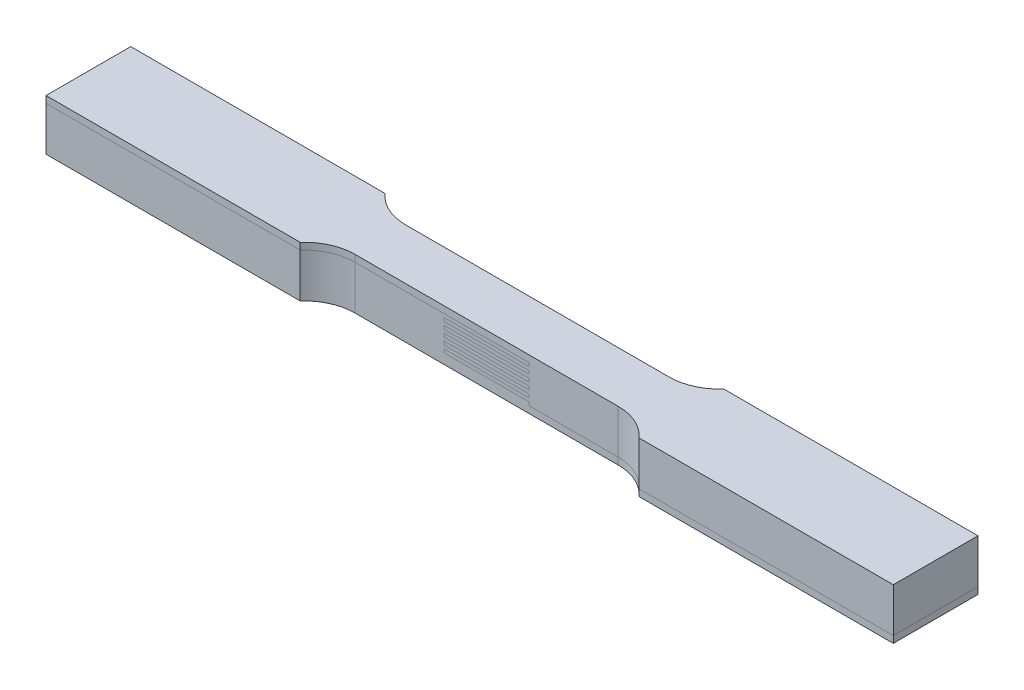
from build123d import *

# Parameters (mm, degrees)
SKETCH1_W            = 5
SKETCH1_H            = 6
BOSS_EXTRUDE7_DEPTH  = 0.4
BOSS_EXTRUDE8_DEPTH  = 0.4
SKETCH4_W            = 5
SKETCH4_H            = 6
BOSS_EXTRUDE9_DEPTH  = 0.4
BOSS_EXTRUDE10_DEPTH = 0.4
LPATTERN2_COUNT      = 25
LPATTERN2_PITCH      = 0.8
LPATTERN3_COUNT      = 25
LPATTERN3_PITCH      = 0.8
BOSS_EXTRUDE11_DEPTH = 0.8
CUT_EXTRUDE1_DEPTH   = 15.6
BOSS_EXTRUDE12_DEPTH = 0.8


with BuildPart() as part:
    # Sketch1 → Boss-Extrude7 (new body)
    with BuildSketch(Plane(origin=(0, 0, 0), x_dir=(1, 0, 0), z_dir=(0, 1, 0))):
        with BuildLine():
            Line((-5, -3), (-5, 3))
            Line((-5, 3), (-15.527864045, 3))
            ThreePointArc((-15.527864045, 3), (-17.977353788, 3.522774425), (-20, 5))
            Line((-20, 5), (-50, 5))
            Line((-50, 5), (-50, -5))
            Line((-50, -5), (-20, -5))
            ThreePointArc((-20, -5), (-17.977353788, -3.522774425), (-15.527864045, -3))
            Line((-15.527864045, -3), (-5, -3))
        make_face()
        with Locations((-2.5, 0)):
            Rectangle(SKETCH1_W, SKETCH1_H)
        with Locations((2.5, 0)):
            Rectangle(SKETCH1_W, SKETCH1_H)
    extrude(amount=BOSS_EXTRUDE7_DEPTH)

    # Sketch4<3> → Boss-Extrude10 (add)
    with BuildSketch(Plane(origin=(0, 0.4, 0), x_dir=(1, 0, 0), z_dir=(0, 1, 0))):
        with BuildLine():
            Line((-5, -3), (-5, 3))
            Line((-5, 3), (-15.527864045, 3))
            ThreePointArc((-15.527864045, 3), (-17.977353788, 3.522774425), (-20, 5))
            Line((-20, 5), (-50, 5))
            Line((-50, 5), (-50, -5))
            Line((-50, -5), (-20, -5))
            ThreePointArc((-20, -5), (-17.977353788, -3.522774425), (-15.527864045, -3))
            Line((-15.527864045, -3), (-5, -3))
        make_face()
    extrude(amount=BOSS_EXTRUDE10_DEPTH)


with BuildPart() as body_2:
    # Sketch1<3> → Boss-Extrude8 (new body)
    with BuildSketch(Plane(origin=(0, 0, 0), x_dir=(1, 0, 0), z_dir=(0, 1, 0))):
        with BuildLine():
            ThreePointArc((20, 5), (17.977353788, 3.522774425), (15.527864045, 3))
            Line((15.527864045, 3), (5, 3))
            Line((5, 3), (5, -3))
            Line((5, -3), (15.527864045, -3))
            ThreePointArc((15.527864045, -3), (17.977353788, -3.522774425), (20, -5))
            Line((20, -5), (50, -5))
            Line((50, -5), (50, 5))
            Line((50, 5), (20, 5))
        make_face()
    extrude(amount=BOSS_EXTRUDE8_DEPTH)

    # Sketch4 → Boss-Extrude9 (add)
    with BuildSketch(Plane(origin=(0, 0.4, 0), x_dir=(1, 0, 0), z_dir=(0, 1, 0))):
        with BuildLine():
            ThreePointArc((20, -5), (17.977353788, -3.522774425), (15.527864045, -3))
            Line((15.527864045, -3), (5, -3))
            Line((5, -3), (5, 3))
            Line((5, 3), (15.527864045, 3))
            ThreePointArc((15.527864045, 3), (17.977353788, 3.522774425), (20, 5))
            Line((20, 5), (50, 5))
            Line((50, 5), (50, -5))
            Line((50, -5), (20, -5))
        make_face()
        with Locations((2.5, 0)):
            Rectangle(SKETCH4_W, SKETCH4_H)
        with Locations((-2.5, 0)):
            Rectangle(SKETCH4_W, SKETCH4_H)
    extrude(amount=BOSS_EXTRUDE9_DEPTH)


with BuildPart() as lpattern2_1:
    # LPattern2: pattern copy
    add(part.part.moved(Location(Vector(0, 1, 0) * (1 * LPATTERN2_PITCH))))


with BuildPart() as lpattern2_2:
    # LPattern2: pattern copy
    add(part.part.moved(Location(Vector(0, 1, 0) * (2 * LPATTERN2_PITCH))))


with BuildPart() as lpattern2_3:
    # LPattern2: pattern copy
    add(part.part.moved(Location(Vector(0, 1, 0) * (3 * LPATTERN2_PITCH))))


with BuildPart() as lpattern2_4:
    # LPattern2: pattern copy
    add(part.part.moved(Location(Vector(0, 1, 0) * (4 * LPATTERN2_PITCH))))


with BuildPart() as lpattern2_5:
    # LPattern2: pattern copy
    add(part.part.moved(Location(Vector(0, 1, 0) * (5 * LPATTERN2_PITCH))))


with BuildPart() as lpattern2_6:
    # LPattern2: pattern copy
    add(part.part.moved(Location(Vector(0, 1, 0) * (6 * LPATTERN2_PITCH))))


with BuildPart() as lpattern2_7:
    # LPattern2: pattern copy
    add(part.part.moved(Location(Vector(0, 1, 0) * (7 * LPATTERN2_PITCH))))


with BuildPart() as lpattern2_8:
    # LPattern2: pattern copy
    add(part.part.moved(Location(Vector(0, 1, 0) * (8 * LPATTERN2_PITCH))))


with BuildPart() as lpattern2_9:
    # LPattern2: pattern copy
    add(part.part.moved(Location(Vector(0, 1, 0) * (9 * LPATTERN2_PITCH))))


with BuildPart() as lpattern2_10:
    # LPattern2: pattern copy
    add(part.part.moved(Location(Vector(0, 1, 0) * (10 * LPATTERN2_PITCH))))


with BuildPart() as lpattern2_11:
    # LPattern2: pattern copy
    add(part.part.moved(Location(Vector(0, 1, 0) * (11 * LPATTERN2_PITCH))))


with BuildPart() as lpattern2_12:
    # LPattern2: pattern copy
    add(part.part.moved(Location(Vector(0, 1, 0) * (12 * LPATTERN2_PITCH))))


with BuildPart() as lpattern2_13:
    # LPattern2: pattern copy
    add(part.part.moved(Location(Vector(0, 1, 0) * (13 * LPATTERN2_PITCH))))


with BuildPart() as lpattern2_14:
    # LPattern2: pattern copy
    add(part.part.moved(Location(Vector(0, 1, 0) * (14 * LPATTERN2_PITCH))))


with BuildPart() as lpattern2_15:
    # LPattern2: pattern copy
    add(part.part.moved(Location(Vector(0, 1, 0) * (15 * LPATTERN2_PITCH))))


with BuildPart() as lpattern2_16:
    # LPattern2: pattern copy
    add(part.part.moved(Location(Vector(0, 1, 0) * (16 * LPATTERN2_PITCH))))


with BuildPart() as lpattern2_17:
    # LPattern2: pattern copy
    add(part.part.moved(Location(Vector(0, 1, 0) * (17 * LPATTERN2_PITCH))))


with BuildPart() as lpattern2_18:
    # LPattern2: pattern copy
    add(part.part.moved(Location(Vector(0, 1, 0) * (18 * LPATTERN2_PITCH))))


with BuildPart() as lpattern2_19:
    # LPattern2: pattern copy
    add(part.part.moved(Location(Vector(0, 1, 0) * (19 * LPATTERN2_PITCH))))


with BuildPart() as lpattern2_20:
    # LPattern2: pattern copy
    add(part.part.moved(Location(Vector(0, 1, 0) * (20 * LPATTERN2_PITCH))))


with BuildPart() as lpattern2_21:
    # LPattern2: pattern copy
    add(part.part.moved(Location(Vector(0, 1, 0) * (21 * LPATTERN2_PITCH))))


with BuildPart() as lpattern2_22:
    # LPattern2: pattern copy
    add(part.part.moved(Location(Vector(0, 1, 0) * (22 * LPATTERN2_PITCH))))


with BuildPart() as lpattern2_23:
    # LPattern2: pattern copy
    add(part.part.moved(Location(Vector(0, 1, 0) * (23 * LPATTERN2_PITCH))))


with BuildPart() as lpattern2_24:
    # LPattern2: pattern copy
    add(part.part.moved(Location(Vector(0, 1, 0) * (24 * LPATTERN2_PITCH))))


with BuildPart() as lpattern2_23_1:
    add(lpattern2_23.part)

    # Combine1: union LPattern2_22, LPattern2_21, LPattern2_20, LPattern2_19, LPattern2_18, LPattern2_17, LPattern2_16, LPattern2_15, LPattern2_14, LPattern2_13, LPattern2_12, LPattern2_11, LPattern2_10, LPattern2_9, LPattern2_8, LPattern2_7, LPattern2_6, LPattern2_5, LPattern2_4, LPattern2_3, LPattern2_2, LPattern2_1, part, LPattern2_24
    add(lpattern2_22.part)
    add(lpattern2_21.part)
    add(lpattern2_20.part)
    add(lpattern2_19.part)
    add(lpattern2_18.part)
    add(lpattern2_17.part)
    add(lpattern2_16.part)
    add(lpattern2_15.part)
    add(lpattern2_14.part)
    add(lpattern2_13.part)
    add(lpattern2_12.part)
    add(lpattern2_11.part)
    add(lpattern2_10.part)
    add(lpattern2_9.part)
    add(lpattern2_8.part)
    add(lpattern2_7.part)
    add(lpattern2_6.part)
    add(lpattern2_5.part)
    add(lpattern2_4.part)
    add(lpattern2_3.part)
    add(lpattern2_2.part)
    add(lpattern2_1.part)
    add(part.part)
    add(lpattern2_24.part)

    # Sketch5 → Boss-Extrude11 (add)
    with BuildSketch(Plane.XZ):
        with BuildLine():
            ThreePointArc((-20, -5), (-17.977353788, -3.522774425), (-15.527864045, -3))
            Line((-15.527864045, -3), (5, -3))
            Line((5, -3), (5, 3))
            Line((5, 3), (-15.527864045, 3))
            ThreePointArc((-15.527864045, 3), (-17.977353788, 3.522774425), (-20, 5))
            Line((-20, 5), (-50, 5))
            Line((-50, 5), (-50, -5))
            Line((-50, -5), (-20, -5))
        make_face()
        with BuildLine():
            ThreePointArc((15.527864045, 3), (17.977353788, 3.522774425), (20, 5))
            Line((20, 5), (50, 5))
            Line((50, 5), (50, -5))
            Line((50, -5), (20, -5))
            ThreePointArc((20, -5), (17.977353788, -3.522774425), (15.527864045, -3))
            Line((15.527864045, -3), (5, -3))
            Line((5, -3), (5, 3))
            Line((5, 3), (15.527864045, 3))
        make_face()
    extrude(amount=BOSS_EXTRUDE11_DEPTH)


with BuildPart() as lpattern3_1:
    # LPattern3: pattern copy
    add(body_2.part.moved(Location(Vector(0, 1, 0) * (1 * LPATTERN3_PITCH))))


with BuildPart() as lpattern3_2:
    # LPattern3: pattern copy
    add(body_2.part.moved(Location(Vector(0, 1, 0) * (2 * LPATTERN3_PITCH))))


with BuildPart() as lpattern3_3:
    # LPattern3: pattern copy
    add(body_2.part.moved(Location(Vector(0, 1, 0) * (3 * LPATTERN3_PITCH))))


with BuildPart() as lpattern3_4:
    # LPattern3: pattern copy
    add(body_2.part.moved(Location(Vector(0, 1, 0) * (4 * LPATTERN3_PITCH))))


with BuildPart() as lpattern3_5:
    # LPattern3: pattern copy
    add(body_2.part.moved(Location(Vector(0, 1, 0) * (5 * LPATTERN3_PITCH))))


with BuildPart() as lpattern3_6:
    # LPattern3: pattern copy
    add(body_2.part.moved(Location(Vector(0, 1, 0) * (6 * LPATTERN3_PITCH))))


with BuildPart() as lpattern3_7:
    # LPattern3: pattern copy
    add(body_2.part.moved(Location(Vector(0, 1, 0) * (7 * LPATTERN3_PITCH))))


with BuildPart() as lpattern3_8:
    # LPattern3: pattern copy
    add(body_2.part.moved(Location(Vector(0, 1, 0) * (8 * LPATTERN3_PITCH))))


with BuildPart() as lpattern3_9:
    # LPattern3: pattern copy
    add(body_2.part.moved(Location(Vector(0, 1, 0) * (9 * LPATTERN3_PITCH))))


with BuildPart() as lpattern3_10:
    # LPattern3: pattern copy
    add(body_2.part.moved(Location(Vector(0, 1, 0) * (10 * LPATTERN3_PITCH))))


with BuildPart() as lpattern3_11:
    # LPattern3: pattern copy
    add(body_2.part.moved(Location(Vector(0, 1, 0) * (11 * LPATTERN3_PITCH))))


with BuildPart() as lpattern3_12:
    # LPattern3: pattern copy
    add(body_2.part.moved(Location(Vector(0, 1, 0) * (12 * LPATTERN3_PITCH))))


with BuildPart() as lpattern3_13:
    # LPattern3: pattern copy
    add(body_2.part.moved(Location(Vector(0, 1, 0) * (13 * LPATTERN3_PITCH))))


with BuildPart() as lpattern3_14:
    # LPattern3: pattern copy
    add(body_2.part.moved(Location(Vector(0, 1, 0) * (14 * LPATTERN3_PITCH))))


with BuildPart() as lpattern3_15:
    # LPattern3: pattern copy
    add(body_2.part.moved(Location(Vector(0, 1, 0) * (15 * LPATTERN3_PITCH))))


with BuildPart() as lpattern3_16:
    # LPattern3: pattern copy
    add(body_2.part.moved(Location(Vector(0, 1, 0) * (16 * LPATTERN3_PITCH))))


with BuildPart() as lpattern3_17:
    # LPattern3: pattern copy
    add(body_2.part.moved(Location(Vector(0, 1, 0) * (17 * LPATTERN3_PITCH))))


with BuildPart() as lpattern3_18:
    # LPattern3: pattern copy
    add(body_2.part.moved(Location(Vector(0, 1, 0) * (18 * LPATTERN3_PITCH))))


with BuildPart() as lpattern3_19:
    # LPattern3: pattern copy
    add(body_2.part.moved(Location(Vector(0, 1, 0) * (19 * LPATTERN3_PITCH))))


with BuildPart() as lpattern3_20:
    # LPattern3: pattern copy
    add(body_2.part.moved(Location(Vector(0, 1, 0) * (20 * LPATTERN3_PITCH))))


with BuildPart() as lpattern3_21:
    # LPattern3: pattern copy
    add(body_2.part.moved(Location(Vector(0, 1, 0) * (21 * LPATTERN3_PITCH))))


with BuildPart() as lpattern3_22:
    # LPattern3: pattern copy
    add(body_2.part.moved(Location(Vector(0, 1, 0) * (22 * LPATTERN3_PITCH))))


with BuildPart() as lpattern3_23:
    # LPattern3: pattern copy
    add(body_2.part.moved(Location(Vector(0, 1, 0) * (23 * LPATTERN3_PITCH))))


with BuildPart() as lpattern3_24:
    # LPattern3: pattern copy
    add(body_2.part.moved(Location(Vector(0, 1, 0) * (24 * LPATTERN3_PITCH))))


with BuildPart() as lpattern3_20_1:
    add(lpattern3_20.part)

    # Combine3: read off the stored shape, not the designer's step
    # Combine3: union body 2, LPattern3_2, LPattern3_3, LPattern3_4, LPattern3_5, LPattern3_6, LPattern3_7, LPattern3_8, LPattern3_9, LPattern3_10, LPattern3_11, LPattern3_12, LPattern3_13, LPattern3_14, LPattern3_15, LPattern3_16, LPattern3_17, LPattern3_18, LPattern3_19, LPattern3_21, LPattern3_22, LPattern3_23, LPattern3_24, LPattern3_1
    add(body_2.part)
    add(lpattern3_2.part)
    add(lpattern3_3.part)
    add(lpattern3_4.part)
    add(lpattern3_5.part)
    add(lpattern3_6.part)
    add(lpattern3_7.part)
    add(lpattern3_8.part)
    add(lpattern3_9.part)
    add(lpattern3_10.part)
    add(lpattern3_11.part)
    add(lpattern3_12.part)
    add(lpattern3_13.part)
    add(lpattern3_14.part)
    add(lpattern3_15.part)
    add(lpattern3_16.part)
    add(lpattern3_17.part)
    add(lpattern3_18.part)
    add(lpattern3_19.part)
    add(lpattern3_21.part)
    add(lpattern3_22.part)
    add(lpattern3_23.part)
    add(lpattern3_24.part)
    add(lpattern3_1.part)


with BuildPart() as cut_extrude1_tool:
    # Sketch6 → Cut-Extrude1 (new body)
    with BuildSketch(Plane(origin=(0, 20, 0), x_dir=(1, 0, 0), z_dir=(0, 1, 0))):
        with BuildLine():
            Line((-15.527864045, -3), (-5, -3))
            Line((-5, -3), (-5, 3))
            Line((-5, 3), (-15.527864045, 3))
            ThreePointArc((-15.527864045, 3), (-17.977353788, 3.522774425), (-20, 5))
            Line((-20, 5), (-50, 5))
            Line((-50, 5), (-50, -5))
            Line((-50, -5), (-20, -5))
            ThreePointArc((-20, -5), (-17.977353788, -3.522774425), (-15.527864045, -3))
        make_face()
        with BuildLine():
            ThreePointArc((15.527864045, 3), (17.977353788, 3.522774425), (20, 5))
            Line((20, 5), (50, 5))
            Line((50, 5), (50, -5))
            Line((50, -5), (20, -5))
            ThreePointArc((20, -5), (17.977353788, -3.522774425), (15.527864045, -3))
            Line((15.527864045, -3), (-5, -3))
            Line((-5, -3), (-5, 3))
            Line((-5, 3), (15.527864045, 3))
        make_face()
    extrude(amount=-CUT_EXTRUDE1_DEPTH)


with BuildPart() as lpattern2_23_2:
    add(lpattern2_23_1.part)

    # Cut-Extrude1: cut by cut_extrude1_tool
    add(cut_extrude1_tool.part, mode=Mode.SUBTRACT)


with BuildPart() as lpattern3_20_2:
    add(lpattern3_20_1.part)

    # Cut-Extrude1: cut by cut_extrude1_tool
    add(cut_extrude1_tool.part, mode=Mode.SUBTRACT)

    # Sketch7 → Boss-Extrude12 (add)
    with BuildSketch(Plane(origin=(0, 4.4, 0), x_dir=(1, 0, 0), z_dir=(0, 1, 0))):
        with BuildLine():
            ThreePointArc((15.527864045, 3), (17.977353788, 3.522774425), (20, 5))
            Line((20, 5), (50, 5))
            Line((50, 5), (50, -5))
            Line((50, -5), (20, -5))
            ThreePointArc((20, -5), (17.977353788, -3.522774425), (15.527864045, -3))
            Line((15.527864045, -3), (5, -3))
            Line((5, -3), (5, 3))
            Line((5, 3), (15.527864045, 3))
        make_face()
        with BuildLine():
            Line((5, -3), (5, 3))
            Line((5, 3), (-15.527864045, 3))
            ThreePointArc((-15.527864045, 3), (-17.977353788, 3.522774425), (-20, 5))
            Line((-20, 5), (-50, 5))
            Line((-50, 5), (-50, -5))
            Line((-50, -5), (-20, -5))
            ThreePointArc((-20, -5), (-17.977353788, -3.522774425), (-15.527864045, -3))
            Line((-15.527864045, -3), (5, -3))
        make_face()
    extrude(amount=BOSS_EXTRUDE12_DEPTH)


solid = Compound([lpattern2_23_2.part, lpattern3_20_2.part])
